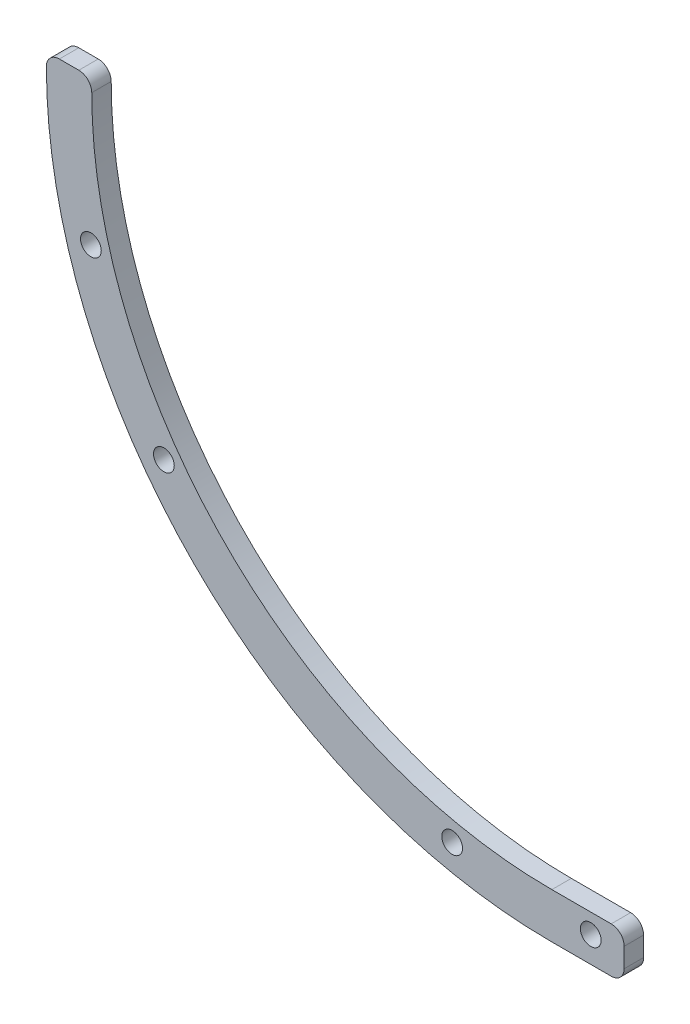
from build123d import *

# Parameters (mm, degrees)
SKETCH_2_R          = 1.6
EXTRUDE_1_DEPTH     = 3
SKETCH_4_W          = 6.5
SKETCH_4_H          = 8
CUT_EXTRUDE_1_DEPTH = 3
SKETCH_6_R          = 1.6
CUT_EXTRUDE_2_DEPTH = 10
CUT_EXTRUDE_START   = -10
CUT_EXTRUDE_3_DEPTH = 10
FILLET_1_R          = 2


with BuildPart() as part:
    # 草图2 → 凸台-拉伸1 (new body)
    with BuildSketch(Plane.XY):
        with BuildLine():
            Line((-162.154590294, 76.5), (-162.154590294, 66.5))
            ThreePointArc((-162.154590294, 66.5), (-143.702317509, 21.952272785), (-99.154590294, 3.5))
            Line((-99.154590294, 3.5), (-88, 3.5))
            Line((-88, 3.5), (-88, -11.5))
            Line((-88, -11.5), (-99.154590294, -11.5))
            ThreePointArc((-99.154590294, -11.5), (-154.308919227, 11.345671067), (-177.154590294, 66.5))
            Line((-177.154590294, 66.5), (-177.154590294, 76.5))
            Line((-177.154590294, 76.5), (-162.154590294, 76.5))
        make_face()
        with Locations((-91.754590294, 1)):
            Circle(SKETCH_2_R, mode=Mode.SUBTRACT)
        with Locations((-99.154590294, 1)):
            Circle(SKETCH_2_R, mode=Mode.SUBTRACT)
        with Locations((-106.910050218, 1.460759219)):
            Circle(SKETCH_2_R, mode=Mode.SUBTRACT)
        with Locations((-114.556398703, 2.836554462)):
            Circle(SKETCH_2_R, mode=Mode.SUBTRACT)
        with Locations((-121.986059394, 5.108029688)):
            Circle(SKETCH_2_R, mode=Mode.SUBTRACT)
        with Locations((-129.094504517, 8.243227549)):
            Circle(SKETCH_2_R, mode=Mode.SUBTRACT)
        with Locations((-135.781725472, 12.198038998)):
            Circle(SKETCH_2_R, mode=Mode.SUBTRACT)
        with Locations((-141.953639856, 16.916823855)):
            Circle(SKETCH_2_R, mode=Mode.SUBTRACT)
        with Locations((-147.523415105, 22.333193613)):
            Circle(SKETCH_2_R, mode=Mode.SUBTRACT)
        with Locations((-152.412690143, 28.370945455)):
            Circle(SKETCH_2_R, mode=Mode.SUBTRACT)
        with Locations((-156.552677837, 34.945134346)):
            Circle(SKETCH_2_R, mode=Mode.SUBTRACT)
        with Locations((-159.885132769, 41.963268131)):
            Circle(SKETCH_2_R, mode=Mode.SUBTRACT)
        with Locations((-162.363170682, 49.326608799)):
            Circle(SKETCH_2_R, mode=Mode.SUBTRACT)
        with Locations((-163.951928103, 56.931561629)):
            Circle(SKETCH_2_R, mode=Mode.SUBTRACT)
        with Locations((-164.62905283, 64.671132664)):
            Circle(SKETCH_2_R, mode=Mode.SUBTRACT)
        with Locations((-164.654590294, 72.371090315)):
            Circle(SKETCH_2_R, mode=Mode.SUBTRACT)
    extrude(amount=EXTRUDE_1_DEPTH)

    # 草图4 → 切除-拉伸1 (cut)
    with BuildSketch(Plane.XY.offset(3)):
        with Locations((-173.904590294, 72.5)):
            Rectangle(SKETCH_4_W, SKETCH_4_H)
    extrude(amount=-CUT_EXTRUDE_1_DEPTH, mode=Mode.SUBTRACT)

    # 草图6 → 切除-拉伸2 (cut)
    with BuildSketch(Plane.XY.offset(3)):
        with Locations((-170.287955794, 46.10283567)):
            Circle(SKETCH_6_R)
        with Locations((-159.021847878, 23.00389133)):
            Circle(SKETCH_6_R)
        with Locations((-114.540055415, -5.882922454)):
            Circle(SKETCH_6_R)
        with Locations((-93.154590294, -7.5)):
            Circle(SKETCH_6_R)
    extrude(amount=-CUT_EXTRUDE_2_DEPTH, mode=Mode.SUBTRACT)

    # 草图8 → 切除-拉伸3 (cut)
    with BuildSketch(Plane.XY.offset(3).offset(CUT_EXTRUDE_START)):
        with BuildLine():
            Line((-88, 3.5), (-99.154590294, 3.5))
            ThreePointArc((-99.154590294, 3.5), (-143.702317509, 21.952272785), (-162.154590294, 66.5))
            Line((-162.154590294, 66.5), (-162.154590294, 76.5))
            Line((-162.154590294, 76.5), (-170.654590294, 76.5))
            Line((-170.654590294, 76.5), (-170.654590294, 68.5))
            Line((-170.654590294, 68.5), (-170.154590294, 68.5))
            Line((-170.154590294, 68.5), (-170.154590294, 66.5))
            ThreePointArc((-170.154590294, 66.5), (-149.359171759, 16.295418536), (-99.154590294, -4.5))
            Line((-99.154590294, -4.5), (-88, -4.5))
            Line((-88, -4.5), (-88, 3.5))
        make_face()
    extrude(amount=CUT_EXTRUDE_3_DEPTH, mode=Mode.SUBTRACT)

    # 圆角1
    fillet_1_edges = [part.edges().sort_by_distance(p)[0] for p in [
        (-177.154590294, 68.5, 1.5),
        (-88, -11.5, 1.5),
        (-88, -4.5, 1.5),
        (-170.154590294, 68.5, 1.5),
    ]]
    fillet(fillet_1_edges, radius=FILLET_1_R - 0.0001)  # a hair under: the kernel refuses the full size


solid = part.part
